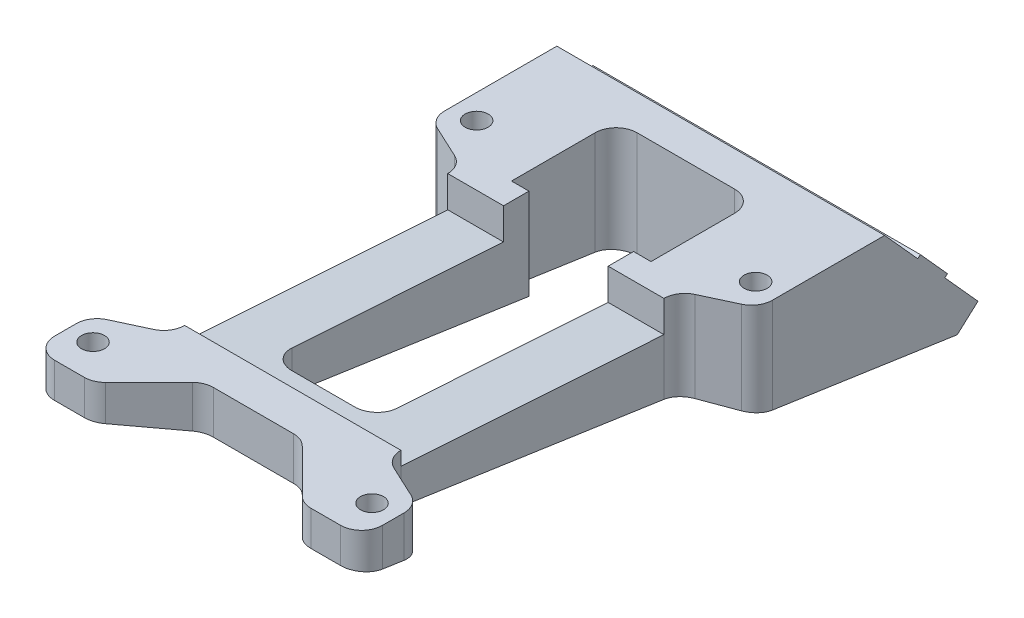
from build123d import *

# Parameters (mm, degrees)
EXTRUDE_2_DEPTH     = 5
SKETCH_3_R          = 1.65
CUT_EXTRUDE_1_DEPTH = 79.754364958
EXTRUDE_3_DEPTH     = 23.5
SKETCH_6_R          = 2.6
CUT_EXTRUDE_3_DEPTH = 83.719354566
CUT_EXTRUDE_4_REACH = 89.719
CUT_EXTRUDE_START   = -5
SKETCH_7_R          = 4.5
CUT_EXTRUDE_5_REACH = 85.529
CUT_EXTRUDE_START_2 = 3
SKETCH_8_R          = 3
CUT_EXTRUDE_2_DEPTH = 81.528760183
FILLET_1_R          = 3
CUT_EXTRUDE_7_DEPTH = 86.458978623


with BuildPart() as part:
    # 草图2 → 凸台-拉伸2 (new body)
    with BuildSketch(Plane(origin=(0, 0, 0), x_dir=(1, 0, 0), z_dir=(0, 1, 0))):
        Polygon((0, 0), (23.5, 0), (23.5, -14), (23.5, -75), (0, -75), align=None)
    extrude_2 = extrude(amount=EXTRUDE_2_DEPTH)

    # 镜向1: 凸台-拉伸2 across plane
    add(extrude_2.mirror(Plane(origin=(0, 5, 75), x_dir=(0, 0, 1), z_dir=(1, 0, 0))))

    # 草图3 → 切除-拉伸1 (cut, through all)
    with BuildSketch(Plane(origin=(0, 5, 0), x_dir=(1, 0, 0), z_dir=(0, 1, 0))):
        with Locations(Location((-20, -15, 0), (0, 0, 270))):
            Circle(SKETCH_3_R)
        with Locations(Location((20, -15, 0), (0, 0, 270))):
            Circle(SKETCH_3_R)
        with Locations(Location((-20, -70, 0), (0, 0, 270))):
            Circle(SKETCH_3_R)
        with Locations(Location((20, -70, 0), (0, 0, 270))):
            Circle(SKETCH_3_R)
    extrude(amount=-CUT_EXTRUDE_1_DEPTH, mode=Mode.SUBTRACT)

    # 草图5 → 凸台-拉伸3 (add, symmetric)
    with BuildSketch(Plane(origin=(0, 0, 0), x_dir=(0, 0, -1), z_dir=(1, 0, 0))):
        Polygon((-75, 0), (10.410032825, -12.539418935), (13.382612127, -9.86289651), (0, 5), (0, 0), align=None)
        Polygon((4.750827305, -0.276328261), (8.631784822, -4.586568249), (9.003357235, -4.252002945), (5.122399718, 0.058237042), align=None)
    extrude(amount=EXTRUDE_3_DEPTH, both=True)

    # 草图6 → 切除-拉伸3 (cut, through all)
    with BuildSketch(Plane(origin=(0, 2.573244145, -2.857877151), x_dir=(1, 0, 0), z_dir=(0, 0.6691306063588544, -0.7431448254773979))):
        with Locations(Location((-13.5, 6.284275873, 0), (0, 0, 270))):
            Circle(SKETCH_6_R)
        with Locations(Location((13.5, 6.284275873, 0), (0, 0, 270))):
            Circle(SKETCH_6_R)
    extrude(amount=-CUT_EXTRUDE_3_DEPTH, mode=Mode.SUBTRACT)

    # 切除-拉伸4: up to this plane
    cut_extrude_4_end = Plane(origin=(23.5, -10.778746663, 1.582474746), z_dir=(0, 0.9893939239349117, -0.145257231423012))
    # 草图7 → 切除-拉伸4 (cut, up to the surface)
    with BuildSketch(Plane(origin=(0, 2.573244145, -2.857877151), x_dir=(1, 0, 0), z_dir=(0, 0.6691306063588544, -0.7431448254773979)).offset(CUT_EXTRUDE_START), mode=Mode.PRIVATE) as cut_extrude_4_sk1:
        with Locations(Location((-13.5, 6.284275873, 0), (0, 0, 270))):
            Circle(SKETCH_7_R)
    cut_extrude_4_tool1 = split(extrude(cut_extrude_4_sk1.sketch, amount=-CUT_EXTRUDE_4_REACH, mode=Mode.PRIVATE), bisect_by=cut_extrude_4_end, keep=Keep.BOTH, mode=Mode.PRIVATE)
    add(cut_extrude_4_tool1.solids().sort_by_distance((-13.5, -5.442536, -3.347154))[0], mode=Mode.SUBTRACT)
    # 草图7 → 切除-拉伸4 (cut, up to the surface)
    with BuildSketch(Plane(origin=(0, 2.573244145, -2.857877151), x_dir=(1, 0, 0), z_dir=(0, 0.6691306063588544, -0.7431448254773979)).offset(CUT_EXTRUDE_START), mode=Mode.PRIVATE) as cut_extrude_4_sk2:
        with Locations(Location((13.5, 6.284275873, 0), (0, 0, 270))):
            Circle(SKETCH_7_R)
    cut_extrude_4_tool2 = split(extrude(cut_extrude_4_sk2.sketch, amount=-CUT_EXTRUDE_4_REACH, mode=Mode.PRIVATE), bisect_by=cut_extrude_4_end, keep=Keep.BOTH, mode=Mode.PRIVATE)
    add(cut_extrude_4_tool2.solids().sort_by_distance((13.5, -5.442536, -3.347154))[0], mode=Mode.SUBTRACT)

    # 切除-拉伸5: up to this plane
    cut_extrude_5_end = Plane(origin=(23.5, -10.778746663, 1.582474746), z_dir=(0, 0.9893939239349117, -0.145257231423012))
    # 草图8 → 切除-拉伸5 (cut, up to the surface)
    with BuildSketch(Plane.XZ.offset(-5).offset(CUT_EXTRUDE_START_2), mode=Mode.PRIVATE) as cut_extrude_5_sk1:
        with Locations(Location((-20, 15, 0), (0, 0, 90))):
            Circle(SKETCH_8_R)
    cut_extrude_5_tool1 = split(extrude(cut_extrude_5_sk1.sketch, amount=CUT_EXTRUDE_5_REACH, mode=Mode.PRIVATE), bisect_by=cut_extrude_5_end, keep=Keep.BOTH, mode=Mode.PRIVATE)
    add(cut_extrude_5_tool1.solids().sort_by_distance((-20, 2, 15))[0], mode=Mode.SUBTRACT)
    # 草图8 → 切除-拉伸5 (cut, up to the surface)
    with BuildSketch(Plane.XZ.offset(-5).offset(CUT_EXTRUDE_START_2), mode=Mode.PRIVATE) as cut_extrude_5_sk2:
        with Locations(Location((20, 15, 0), (0, 0, 90))):
            Circle(SKETCH_8_R)
    cut_extrude_5_tool2 = split(extrude(cut_extrude_5_sk2.sketch, amount=CUT_EXTRUDE_5_REACH, mode=Mode.PRIVATE), bisect_by=cut_extrude_5_end, keep=Keep.BOTH, mode=Mode.PRIVATE)
    add(cut_extrude_5_tool2.solids().sort_by_distance((20, 2, 15))[0], mode=Mode.SUBTRACT)
    # 草图8 → 切除-拉伸5 (cut, up to the surface)
    with BuildSketch(Plane.XZ.offset(-5).offset(CUT_EXTRUDE_START_2), mode=Mode.PRIVATE) as cut_extrude_5_sk3:
        with Locations(Location((20, 70, 0), (0, 0, 90))):
            Circle(SKETCH_8_R)
    cut_extrude_5_tool3 = split(extrude(cut_extrude_5_sk3.sketch, amount=CUT_EXTRUDE_5_REACH, mode=Mode.PRIVATE), bisect_by=cut_extrude_5_end, keep=Keep.BOTH, mode=Mode.PRIVATE)
    add(cut_extrude_5_tool3.solids().sort_by_distance((20, 2, 70))[0], mode=Mode.SUBTRACT)
    # 草图8 → 切除-拉伸5 (cut, up to the surface)
    with BuildSketch(Plane.XZ.offset(-5).offset(CUT_EXTRUDE_START_2), mode=Mode.PRIVATE) as cut_extrude_5_sk4:
        with Locations(Location((-20, 70, 0), (0, 0, 90))):
            Circle(SKETCH_8_R)
    cut_extrude_5_tool4 = split(extrude(cut_extrude_5_sk4.sketch, amount=CUT_EXTRUDE_5_REACH, mode=Mode.PRIVATE), bisect_by=cut_extrude_5_end, keep=Keep.BOTH, mode=Mode.PRIVATE)
    add(cut_extrude_5_tool4.solids().sort_by_distance((-20, 2, 70))[0], mode=Mode.SUBTRACT)

    # 草图4 → 切除-拉伸2 (cut, through all)
    with BuildSketch(Plane(origin=(0, 5, 0), x_dir=(1, 0, 0), z_dir=(0, 1, 0))):
        Polygon((-10, -5), (-10, -20), (-7.5, -20), (-7.5, -57), (7.5, -57), (7.5, -20), (10, -20), (10, -5), align=None)
        Polygon((-7, -67), (-15, -75), (15, -75), (7, -67), align=None)
        Polygon((-23.5, -18), (-23.5, -67), (-15.5, -63.269538735), (-15.5, -21.730461265), align=None)
        Polygon((23.5, -18), (15.5, -21.730461265), (15.5, -63.269538735), (23.5, -67), align=None)
    extrude(amount=-CUT_EXTRUDE_2_DEPTH, mode=Mode.SUBTRACT)

    # 圆角1
    # the kernel refuses this fillet: 3 mm, written as the material it adds along each edge
    with BuildSketch(Plane(origin=(7.5, 5, 57), x_dir=(0, 0, -1), z_dir=(0, -1, 0))) as fillet_1_piece_1_section:
        with BuildLine():
            CenterArc((FILLET_1_R, -FILLET_1_R), FILLET_1_R, 90, 90)
            Line((0, -FILLET_1_R), (0, 0))
            Line((0, 0), (FILLET_1_R, 0))
        make_face()
    fillet_1_piece_1 = extrude(amount=15.142658402, mode=Mode.PRIVATE)
    fillet_1_piece_1 = split(fillet_1_piece_1, bisect_by=Plane(origin=(6.825500476, -2.66184405, 56.869320354), z_dir=(0, 0.9893939239349115, -0.14525723142301197)), keep=Keep.TOP, mode=Mode.PRIVATE)
    add(fillet_1_piece_1)
    with BuildSketch(Plane(origin=(-7.5, 5, 57), x_dir=(1, 0, 0), z_dir=(0, -1, 0))) as fillet_1_piece_2_section:
        with BuildLine():
            CenterArc((FILLET_1_R, -FILLET_1_R), FILLET_1_R, 90, 90)
            Line((0, -FILLET_1_R), (0, 0))
            Line((0, 0), (FILLET_1_R, 0))
        make_face()
    fillet_1_piece_2 = extrude(amount=15.142658402, mode=Mode.PRIVATE)
    fillet_1_piece_2 = split(fillet_1_piece_2, bisect_by=Plane(origin=(-6.825500476, -2.66184405, 56.869320354), z_dir=(0, 0.9893939239349115, -0.14525723142301197)), keep=Keep.TOP, mode=Mode.PRIVATE)
    add(fillet_1_piece_2)
    with BuildSketch(Plane(origin=(15.5, 5, 21.730461265), x_dir=(0.9063077870366475, 0, -0.4226182617407048), z_dir=(0, -1, 0))) as fillet_1_piece_3_section:
        with BuildLine():
            CenterArc((FILLET_1_R * 0.637070260807, FILLET_1_R), FILLET_1_R, 205, 65)
            Line((-FILLET_1_R * 0.269237526229, FILLET_1_R * 0.577381738259), (0, 0))
            Line((0, 0), (FILLET_1_R * 0.637070260807, 0))
        make_face()
    fillet_1_piece_3 = extrude(amount=17.598759961, mode=Mode.PRIVATE)
    fillet_1_piece_3 = split(fillet_1_piece_3, bisect_by=Plane(origin=(15.879555916, -7.651082655, 22.886004601), z_dir=(0, 0.9893939239349115, -0.14525723142301197)), keep=Keep.TOP, mode=Mode.PRIVATE)
    add(fillet_1_piece_3)
    with BuildSketch(Plane(origin=(15.5, 5, 63.269538735), x_dir=(0.9063077870366488, 0, 0.4226182617407019), z_dir=(0, -1, 0))) as fillet_1_piece_4_section:
        with BuildLine():
            CenterArc((FILLET_1_R * 0.637070260807, -FILLET_1_R), FILLET_1_R, 90, 65)
            Line((-FILLET_1_R * 0.269237526229, -FILLET_1_R * 0.577381738259), (0, 0))
            Line((0, 0), (FILLET_1_R * 0.637070260807, 0))
        make_face()
    fillet_1_piece_4 = extrude(amount=11.500227068, mode=Mode.PRIVATE)
    fillet_1_piece_4 = split(fillet_1_piece_4, bisect_by=Plane(origin=(15.87363951, -1.687245158, 63.507628217), z_dir=(0, 0.9893939239349115, -0.14525723142301197)), keep=Keep.TOP, mode=Mode.PRIVATE)
    add(fillet_1_piece_4)
    with BuildSketch(Plane(origin=(7, 5, 67), x_dir=(-1, 0, 0), z_dir=(0, -1, 0))) as fillet_1_piece_5_section:
        with BuildLine():
            CenterArc((FILLET_1_R * 0.414213562373, -FILLET_1_R), FILLET_1_R, 90, 45)
            Line((-FILLET_1_R * 0.292893218813, -FILLET_1_R * 0.292893218813), (0, 0))
            Line((0, 0), (FILLET_1_R * 0.414213562373, 0))
        make_face()
    fillet_1_piece_5 = extrude(amount=9.281116563, mode=Mode.PRIVATE)
    fillet_1_piece_5 = split(fillet_1_piece_5, bisect_by=Plane(origin=(6.92099422, -1.082611782, 67.625981449), z_dir=(0, 0.9893939239349115, -0.14525723142301197)), keep=Keep.TOP, mode=Mode.PRIVATE)
    add(fillet_1_piece_5)
    with BuildSketch(Plane(origin=(-7, 5, 67), x_dir=(-0.7071067811865526, 0, 0.7071067811865426), z_dir=(0, -1, 0))) as fillet_1_piece_6_section:
        with BuildLine():
            CenterArc((FILLET_1_R * 0.414213562373, -FILLET_1_R), FILLET_1_R, 90, 45)
            Line((-FILLET_1_R * 0.292893218813, -FILLET_1_R * 0.292893218813), (0, 0))
            Line((0, 0), (FILLET_1_R * 0.414213562373, 0))
        make_face()
    fillet_1_piece_6 = extrude(amount=9.281116563, mode=Mode.PRIVATE)
    fillet_1_piece_6 = split(fillet_1_piece_6, bisect_by=Plane(origin=(-6.92099422, -1.082611782, 67.625981449), z_dir=(0, 0.9893939239349115, -0.14525723142301197)), keep=Keep.TOP, mode=Mode.PRIVATE)
    add(fillet_1_piece_6)
    with BuildSketch(Plane(origin=(-15.5, 5, 63.269538735), x_dir=(0, 0, -1), z_dir=(0, -1, 0))) as fillet_1_piece_7_section:
        with BuildLine():
            CenterArc((FILLET_1_R * 0.637070260807, -FILLET_1_R), FILLET_1_R, 90, 65)
            Line((-FILLET_1_R * 0.269237526229, -FILLET_1_R * 0.577381738259), (0, 0))
            Line((0, 0), (FILLET_1_R * 0.637070260807, 0))
        make_face()
    fillet_1_piece_7 = extrude(amount=11.500227068, mode=Mode.PRIVATE)
    fillet_1_piece_7 = split(fillet_1_piece_7, bisect_by=Plane(origin=(-15.87363951, -1.687245158, 63.507628217), z_dir=(0, 0.9893939239349115, -0.14525723142301197)), keep=Keep.TOP, mode=Mode.PRIVATE)
    add(fillet_1_piece_7)
    with BuildSketch(Plane(origin=(-15.5, 5, 21.730461265), x_dir=(-0.9063077870366472, 0, -0.42261826174070566), z_dir=(0, -1, 0))) as fillet_1_piece_8_section:
        with BuildLine():
            CenterArc((FILLET_1_R * 0.637070260807, -FILLET_1_R), FILLET_1_R, 90, 65)
            Line((-FILLET_1_R * 0.269237526229, -FILLET_1_R * 0.577381738259), (0, 0))
            Line((0, 0), (FILLET_1_R * 0.637070260807, 0))
        make_face()
    fillet_1_piece_8 = extrude(amount=17.598759961, mode=Mode.PRIVATE)
    fillet_1_piece_8 = split(fillet_1_piece_8, bisect_by=Plane(origin=(-15.879555916, -7.651082655, 22.886004601), z_dir=(0, 0.9893939239349115, -0.14525723142301197)), keep=Keep.TOP, mode=Mode.PRIVATE)
    add(fillet_1_piece_8)
    with BuildSketch(Plane(origin=(10, 5, 5), x_dir=(-1, 0, 0), z_dir=(0, -1, 0))) as fillet_1_piece_9_section:
        with BuildLine():
            CenterArc((FILLET_1_R, -FILLET_1_R), FILLET_1_R, 90, 90)
            Line((0, -FILLET_1_R), (0, 0))
            Line((0, 0), (FILLET_1_R, 0))
        make_face()
    fillet_1_piece_9 = extrude(amount=21.652323405, mode=Mode.PRIVATE)
    fillet_1_piece_9 = split(fillet_1_piece_9, bisect_by=Plane(origin=(9.315353327, -10.016611336, 6.773624643), z_dir=(0, 0.9893939239349115, -0.14525723142301197)), keep=Keep.TOP, mode=Mode.PRIVATE)
    fillet_1_piece_9 = fillet_1_piece_9 - Plane(origin=(13.5, -8.634898017, 0.198322878), x_dir=(0, 0.7431448254773979, 0.6691306063588544), z_dir=(0, 0.6691306063588544, -0.7431448254773979)) * Cylinder(4.5, 56, mode=Mode.PRIVATE)
    add(fillet_1_piece_9)
    with BuildSketch(Plane(origin=(-10, 5, 5), x_dir=(1, 0, 0), z_dir=(0, -1, 0))) as fillet_1_piece_10_section:
        with BuildLine():
            CenterArc((FILLET_1_R, FILLET_1_R), FILLET_1_R, 180, 90)
            Line((0, FILLET_1_R), (0, 0))
            Line((0, 0), (FILLET_1_R, 0))
        make_face()
    fillet_1_piece_10 = extrude(amount=21.652323405, mode=Mode.PRIVATE)
    fillet_1_piece_10 = split(fillet_1_piece_10, bisect_by=Plane(origin=(-9.315353327, -10.016611336, 6.773624645), z_dir=(0, 0.9893939239349115, -0.14525723142301197)), keep=Keep.TOP, mode=Mode.PRIVATE)
    fillet_1_piece_10 = fillet_1_piece_10 - Plane(origin=(-13.5, -8.634898015, 0.198322875), x_dir=(0, 0.7431448254773979, 0.6691306063588544), z_dir=(0, 0.6691306063588544, -0.7431448254773979)) * Cylinder(4.5, 56, mode=Mode.PRIVATE)
    add(fillet_1_piece_10)
    # the kernel refuses this fillet: 3 mm, written as the material it takes off along each edge
    with BuildSketch(Plane(origin=(23.5, 9.778026956, 18), x_dir=(0, 0, -1), z_dir=(0, -1, 0))) as fillet_1_2_piece_1:
        with BuildLine():
            CenterArc((FILLET_1_R * 0.637070260807, -FILLET_1_R), FILLET_1_R, 90, 65)
            Line((-FILLET_1_R * 0.269237526229, -FILLET_1_R * 0.577381738259), (0, 0))
            Line((0, 0), (FILLET_1_R * 0.637070260807, 0))
        make_face()
    extrude(amount=22.924472184, mode=Mode.SUBTRACT)
    with BuildSketch(Plane(origin=(23.5, 9.778026956, 67), x_dir=(0, 0, 1), z_dir=(0, -1, 0)), Plane(origin=(-23.5, 9.778026956, 67), x_dir=(0.9063077870366487, 0, -0.4226182617407022), z_dir=(0, -1, 0))) as fillet_1_2_piece_2:
        with BuildLine():
            CenterArc((FILLET_1_R * 0.637070260807, FILLET_1_R), FILLET_1_R, 205, 65)
            Line((-FILLET_1_R * 0.269237526229, FILLET_1_R * 0.577381738259), (0, 0))
            Line((0, 0), (FILLET_1_R * 0.637070260807, 0))
        make_face()
    extrude(amount=15.730568757, mode=Mode.SUBTRACT)
    with BuildSketch(Plane(origin=(23.5, -7.5, 75), x_dir=(-1, 0, 0), z_dir=(0, 1, 0))) as fillet_1_2_piece_3:
        with BuildLine():
            CenterArc((FILLET_1_R, -FILLET_1_R), FILLET_1_R, 90, 90)
            Line((0, -FILLET_1_R), (0, 0))
            Line((0, 0), (FILLET_1_R, 0))
        make_face()
    extrude(amount=20, mode=Mode.SUBTRACT)
    with BuildSketch(Plane(origin=(15, 8.106601718, 75), x_dir=(-0.7071067811865526, 0, -0.7071067811865426), z_dir=(0, -1, 0)), Plane(origin=(-15, 8.106601718, 75), x_dir=(-1, 0, 0), z_dir=(0, -1, 0))) as fillet_1_2_piece_4:
        with BuildLine():
            CenterArc((FILLET_1_R * 0.414213562373, FILLET_1_R), FILLET_1_R, 225, 45)
            Line((-FILLET_1_R * 0.292893218813, FILLET_1_R * 0.292893218813), (0, 0))
            Line((0, 0), (FILLET_1_R * 0.414213562373, 0))
        make_face()
    extrude(amount=11.213203436, mode=Mode.SUBTRACT)
    with BuildSketch(Plane(origin=(-23.5, -7.5, 75), x_dir=(1, 0, 0), z_dir=(0, 1, 0))) as fillet_1_2_piece_5:
        with BuildLine():
            CenterArc((FILLET_1_R, FILLET_1_R), FILLET_1_R, 180, 90)
            Line((0, FILLET_1_R), (0, 0))
            Line((0, 0), (FILLET_1_R, 0))
        make_face()
    extrude(amount=20, mode=Mode.SUBTRACT)
    with BuildSketch(Plane(origin=(-23.5, 9.778026956, 18), x_dir=(0, 0, -1), z_dir=(0, -1, 0))) as fillet_1_2_piece_6:
        with BuildLine():
            CenterArc((FILLET_1_R * 0.637070260807, FILLET_1_R), FILLET_1_R, 205, 65)
            Line((-FILLET_1_R * 0.269237526229, FILLET_1_R * 0.577381738259), (0, 0))
            Line((0, 0), (FILLET_1_R * 0.637070260807, 0))
        make_face()
    extrude(amount=22.924472184, mode=Mode.SUBTRACT)

    # 草图10 → 切除-拉伸7 (cut, through all)
    with BuildSketch(Plane.ZY.offset(15.5)):
        Polygon((23.641672048, 5), (23.641672048, 0.5), (61.358327952, 3), (61.358327952, 5), align=None)
    extrude(amount=-CUT_EXTRUDE_7_DEPTH, mode=Mode.SUBTRACT)


solid = part.part
